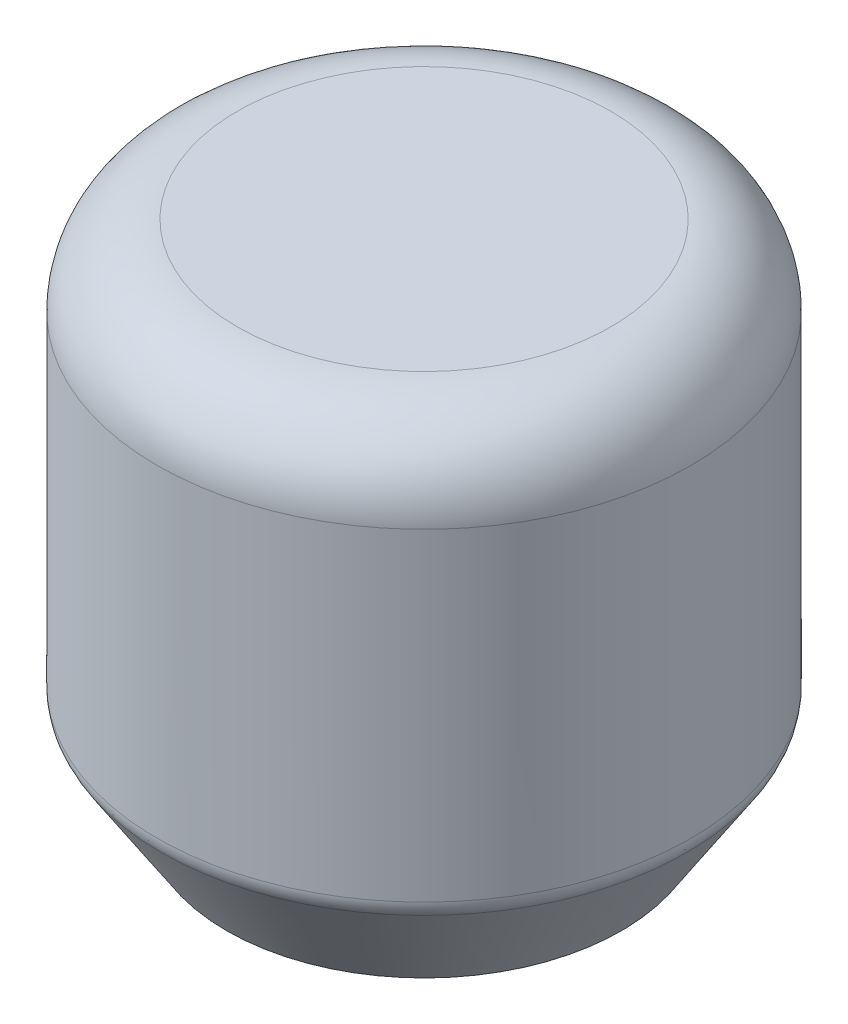
from build123d import *

# Parameters (mm, degrees)
SKETCH1_R           = 127
BOSS_EXTRUDE1_DEPTH = 246.38
FILLET1_R           = 38.1
CHAMFER1_SIZE       = 33.02
CHAMFER1_SIZE2      = 50.846341105
FILLET2_R           = 12.7


with BuildPart() as part:
    # Sketch1 → Boss-Extrude1 (new body)
    with BuildSketch(Plane(origin=(0, 0, 0), x_dir=(1, 0, 0), z_dir=(0, 1, 0))):
        Circle(SKETCH1_R)
    extrude(amount=BOSS_EXTRUDE1_DEPTH)

    # Fillet1
    fillet1_edges = [part.edges().sort_by_distance(p)[0] for p in [
        (-127, 246.38, 0),
    ]]
    fillet(fillet1_edges, radius=FILLET1_R)

    # Chamfer1
    chamfer1_edges = [part.edges().sort_by_distance(p)[0] for p in [
        (-127, 0, 0),
    ]]
    chamfer1_side = [part.faces().sort_by_distance(p)[0] for p in [
        (0, 0, 0),
    ]]
    chamfer(chamfer1_edges, length=CHAMFER1_SIZE, length2=CHAMFER1_SIZE2, reference=chamfer1_side[0])

    # Fillet2
    fillet2_edges = [part.edges().sort_by_distance(p)[0] for p in [
        (-127, 50.846341105, 0),
    ]]
    fillet(fillet2_edges, radius=FILLET2_R)


solid = part.part
